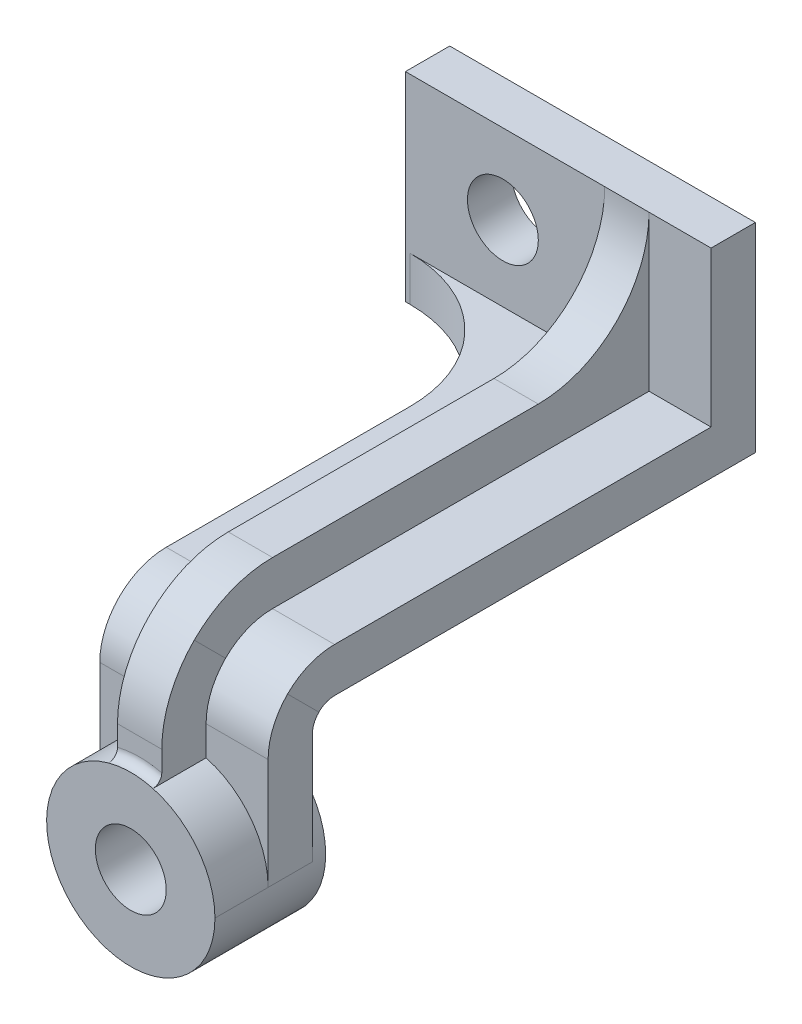
from build123d import *

# Parameters (mm, degrees)
SKETCH1_W                = 69
SKETCH1_H                = 45
BOSS_EXTRUDE1_DEPTH      = 10
BOSS_EXTRUDE2_DEPTH      = 12
BOSS_EXTRUDE2_DEPTH_BACK = 13
SKETCH5_R                = 19
SKETCH6_R                = 8
CUT_EXTRUDE1_DEPTH       = 146.555831213
FILLET1_R                = 25
FILLET2_R                = 15
FILLET3_R                = 5
FILLET4_R                = 2
FILLET5_R                = 25
FILLET6_R                = 30
SKETCH7_R                = 8
CUT_EXTRUDE2_DEPTH       = 138.282555338


with BuildPart() as part:
    # Sketch1 → Boss-Extrude1 (new body)
    with BuildSketch(Plane.XY):
        Rectangle(SKETCH1_W, SKETCH1_H)
    extrude(amount=BOSS_EXTRUDE1_DEPTH)

    # Sweep1: sweep along a path in Sketch3
    with BuildLine(Plane(origin=(15.5, 0, 0), x_dir=(0, 0, -1), z_dir=(1, 0, 0))) as sweep1_path:
        Line((-10, -22.5), (-100, -22.5))
        Line((-100, -22.5), (-100, -52.5))
    # Sketch4 → Sweep1 (sweep)
    with BuildSketch(Plane.XY.offset(10)):
        Polygon((34.5, -22.5), (-3.5, -22.5), (-3.5, -12.5), (10.5, -12.5), (10.5, -2.5), (20.5, -2.5), (20.5, -12.5), (34.5, -12.5), align=None)
    sweep(path=sweep1_path.line, transition=Transition.RIGHT)

    # Sketch5 → Boss-Extrude2 (add, two sides: drawn at the far end of the back side and taken through both)
    with BuildSketch(Plane.XY.offset(110).offset(-BOSS_EXTRUDE2_DEPTH_BACK)):
        with Locations((15.5, -52.5)):
            Circle(SKETCH5_R)
    extrude(amount=BOSS_EXTRUDE2_DEPTH + BOSS_EXTRUDE2_DEPTH_BACK)

    # Sketch6 → Cut-Extrude1 (cut, through all)
    with BuildSketch(Plane.XY.offset(122)):
        with Locations((15.5, -52.5)):
            Circle(SKETCH6_R)
    extrude(amount=-CUT_EXTRUDE1_DEPTH, mode=Mode.SUBTRACT)

    # Fillet1
    fillet1_edges = [part.edges().sort_by_distance(p)[0] for p in [
        (15.5, -2.5, 120),
    ]]
    fillet(fillet1_edges, radius=FILLET1_R)

    # Fillet2
    fillet2_edges = [part.edges().sort_by_distance(p)[0] for p in [
        (3.5, -12.5, 110),
        (27.5, -12.5, 110),
    ]]
    fillet(fillet2_edges, radius=FILLET2_R)

    # Fillet3
    fillet3_edges = [part.edges().sort_by_distance(p)[0] for p in [
        (15.5, -22.5, 100),
    ]]
    fillet(fillet3_edges, radius=FILLET3_R)

    # Fillet4
    fillet4_edges = [part.edges().sort_by_distance(p)[0] for p in [
        (15.5, -33.5, 120),
    ]]
    fillet(fillet4_edges, radius=FILLET4_R - 0.0001)  # a hair under: the kernel refuses the full size

    # Fillet5
    fillet5_edges = [part.edges().sort_by_distance(p)[0] for p in [
        (15.5, -2.5, 10),
    ]]
    fillet(fillet5_edges, radius=FILLET5_R - 0.0001)  # a hair under: the kernel refuses the full size

    # Fillet6
    fillet6_edges = [part.edges().sort_by_distance(p)[0] for p in [
        (-3.5, -17.5, 10),
    ]]
    fillet(fillet6_edges, radius=FILLET6_R)

    # Sketch7 → Cut-Extrude2 (cut, through all)
    with BuildSketch(Plane.XY.offset(10)):
        with Locations((-12.5, 4.5)):
            Circle(SKETCH7_R)
    extrude(amount=-CUT_EXTRUDE2_DEPTH, mode=Mode.SUBTRACT)


solid = part.part
